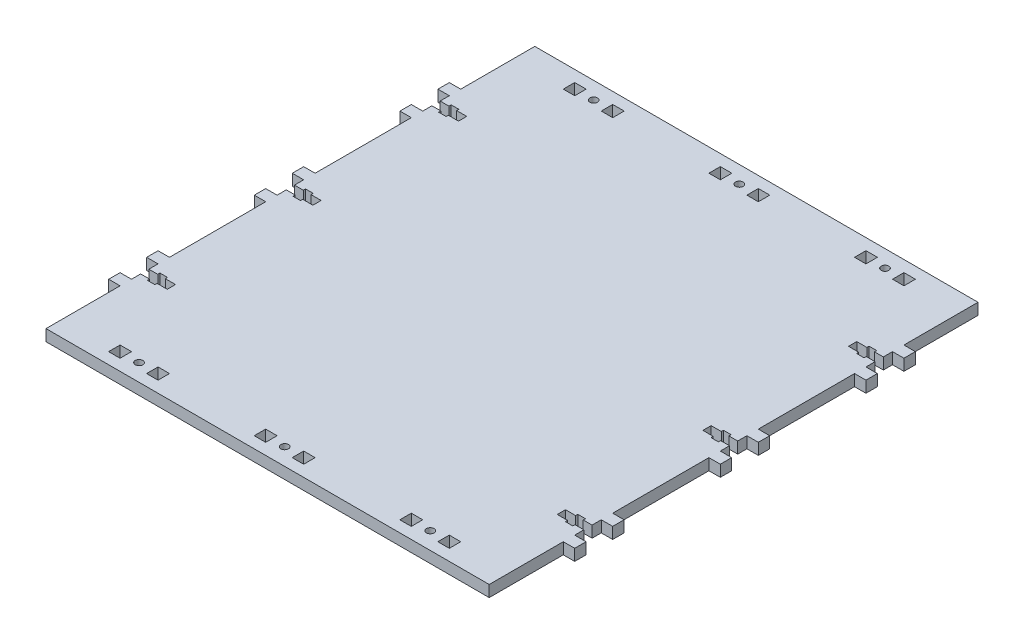
from build123d import *

# Parameters (mm, degrees)
SKETCH1_W           = 9.05
SKETCH1_H           = 9.05
SKETCH1_R           = 3
BOSS_EXTRUDE1_DEPTH = 9


with BuildPart() as part:
    # Sketch1 → Boss-Extrude1 (new body)
    with BuildSketch(Plane(origin=(0, 0, 0), x_dir=(1, 0, 0), z_dir=(0, 1, 0))):
        Polygon((-175, -134.5), (-175, -193), (175, -193), (175, -134.5), (184, -134.5), (184, -125.5), (175, -125.5), (175, -118.25), (168, -118.25), (168, -119.975), (162, -119.975), (162, -118.25), (154, -118.25), (154, -111.75), (162, -111.75), (162, -110.025), (168, -110.025), (168, -111.75), (175, -111.75), (175, -104.5), (184, -104.5), (184, -95.5), (175, -95.5), (175, -19.5), (184, -19.5), (184, -10.5), (175, -10.5), (175, -3.25), (168, -3.25), (168, -4.975), (162, -4.975), (162, -3.25), (154, -3.25), (154, 3.25), (162, 3.25), (162, 4.975), (168, 4.975), (168, 3.25), (175, 3.25), (175, 10.5), (184, 10.5), (184, 19.5), (175, 19.5), (175, 95.5), (184, 95.5), (184, 104.5), (175, 104.5), (175, 111.75), (168, 111.75), (168, 110.025), (162, 110.025), (162, 111.75), (154, 111.75), (154, 118.25), (162, 118.25), (162, 119.975), (168, 119.975), (168, 118.25), (175, 118.25), (175, 125.5), (184, 125.5), (184, 134.5), (175, 134.5), (175, 193), (-175, 193), (-175, 134.5), (-184, 134.5), (-184, 125.5), (-175, 125.5), (-175, 118.25), (-168, 118.25), (-168, 119.975), (-162, 119.975), (-162, 118.25), (-154, 118.25), (-154, 111.75), (-162, 111.75), (-162, 110.025), (-168, 110.025), (-168, 111.75), (-175, 111.75), (-175, 104.5), (-184, 104.5), (-184, 95.5), (-175, 95.5), (-175, 19.5), (-184, 19.5), (-184, 10.5), (-175, 10.5), (-175, 3.25), (-168, 3.25), (-168, 4.975), (-162, 4.975), (-162, 3.25), (-154, 3.25), (-154, -3.25), (-162, -3.25), (-162, -4.975), (-168, -4.975), (-168, -3.25), (-175, -3.25), (-175, -10.5), (-184, -10.5), (-184, -19.5), (-175, -19.5), (-175, -95.5), (-184, -95.5), (-184, -104.5), (-175, -104.5), (-175, -111.75), (-168, -111.75), (-168, -110.025), (-162, -110.025), (-162, -111.75), (-154, -111.75), (-154, -118.25), (-162, -118.25), (-162, -119.975), (-168, -119.975), (-168, -118.25), (-175, -118.25), (-175, -125.5), (-184, -125.5), (-184, -134.5), align=None)
        with Locations((-130, -179.525)):
            Rectangle(SKETCH1_W, SKETCH1_H, mode=Mode.SUBTRACT)
        with Locations((-115, -179.525)):
            Circle(SKETCH1_R, mode=Mode.SUBTRACT)
        with Locations((-100, -179.525)):
            Rectangle(SKETCH1_W, SKETCH1_H, mode=Mode.SUBTRACT)
        with Locations((-15, -179.525)):
            Rectangle(SKETCH1_W, SKETCH1_H, mode=Mode.SUBTRACT)
        with Locations((0, -179.525)):
            Circle(SKETCH1_R, mode=Mode.SUBTRACT)
        with Locations((15, -179.525)):
            Rectangle(SKETCH1_W, SKETCH1_H, mode=Mode.SUBTRACT)
        with Locations((100, -179.525)):
            Rectangle(SKETCH1_W, SKETCH1_H, mode=Mode.SUBTRACT)
        with Locations((115, -179.525)):
            Circle(SKETCH1_R, mode=Mode.SUBTRACT)
        with Locations((130, -179.525)):
            Rectangle(SKETCH1_W, SKETCH1_H, mode=Mode.SUBTRACT)
        with Locations((-130, 179.525)):
            Rectangle(SKETCH1_W, SKETCH1_H, mode=Mode.SUBTRACT)
        with Locations((-115, 179.525)):
            Circle(SKETCH1_R, mode=Mode.SUBTRACT)
        with Locations((-100, 179.525)):
            Rectangle(SKETCH1_W, SKETCH1_H, mode=Mode.SUBTRACT)
        with Locations((-15, 179.525)):
            Rectangle(SKETCH1_W, SKETCH1_H, mode=Mode.SUBTRACT)
        with Locations((0, 179.525)):
            Circle(SKETCH1_R, mode=Mode.SUBTRACT)
        with Locations((15, 179.525)):
            Rectangle(SKETCH1_W, SKETCH1_H, mode=Mode.SUBTRACT)
        with Locations((100, 179.525)):
            Rectangle(SKETCH1_W, SKETCH1_H, mode=Mode.SUBTRACT)
        with Locations((115, 179.525)):
            Circle(SKETCH1_R, mode=Mode.SUBTRACT)
        with Locations((130, 179.525)):
            Rectangle(SKETCH1_W, SKETCH1_H, mode=Mode.SUBTRACT)
    extrude(amount=BOSS_EXTRUDE1_DEPTH)


solid = part.part
